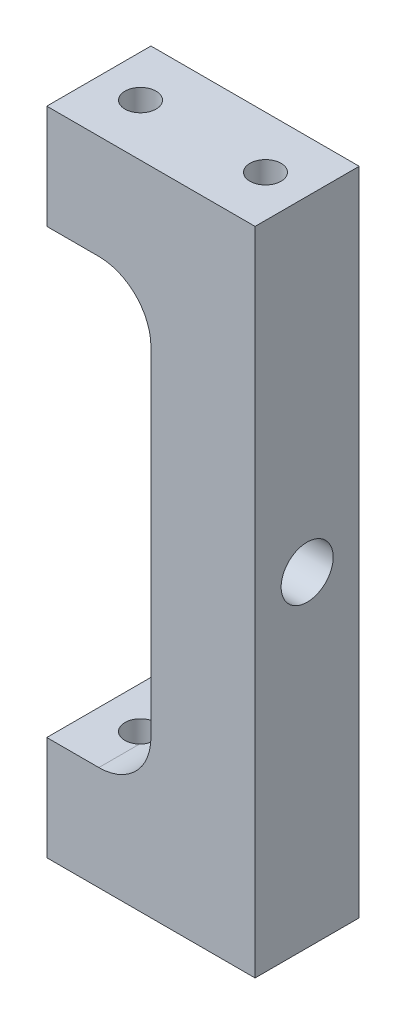
from build123d import *

# Parameters (mm, degrees)
SKETCH1_W                          = 25.4
SKETCH1_H                          = 12.7
STOCK_DEPTH                        = 79.375
SKETCH2_W                          = 12.7
SKETCH2_H                          = 53.975
CUTOUT_DEPTH                       = 85.302079601
FILLET1_R                          = 6.35
F_1_4_0_25_DIAMETER_HOLE1_D        = 6.35
MOUNTING_HOLES_ONE_SIDE_AT_2_COUNT = 2
MOUNTING_HOLES_ONE_SIDE_AT_2_PITCH = 15.24


with BuildPart() as part:
    # Sketch1 → Stock (new body)
    with BuildSketch(Plane(origin=(0, 0, 0), x_dir=(1, 0, 0), z_dir=(0, 1, 0))):
        with Locations((12.7, 6.35)):
            Rectangle(SKETCH1_W, SKETCH1_H)
    extrude(amount=STOCK_DEPTH)

    # Sketch2 → Cutout (cut, through all)
    with BuildSketch(Plane.XY):
        with Locations((6.35, 39.6875)):
            Rectangle(SKETCH2_W, SKETCH2_H)
    extrude(amount=-CUTOUT_DEPTH, mode=Mode.SUBTRACT)

    # Fillet1
    fillet1_edges = [part.edges().sort_by_distance(p)[0] for p in [
        (12.7, 12.7, -6.35),
        (12.7, 66.675, -6.35),
    ]]
    fillet(fillet1_edges, radius=FILLET1_R)

    # 1/4 (0.25) Diameter Hole1 (through all)
    with Locations(Plane.ZY.offset(-12.7)):
        with Locations((-6.35, 39.6875)):
            Hole(F_1_4_0_25_DIAMETER_HOLE1_D / 2)

    # Sketch8 → Mounting Holes One Side (revolve, cut)
    with BuildSketch(Plane(origin=(5.08, 79.375, -6.35), x_dir=(0, 0, 1), z_dir=(1, 0, 0))):
        Polygon((0, 0), (0, 13.840824014), (1.89865, 12.7), (1.89865, 0), align=None)
    mounting_holes_one_side = revolve(axis=Axis((5.08, 85.725, -6.35), (0, -1, 0)), mode=Mode.SUBTRACT)

    # Mounting Holes One Side at 2: Mounting Holes One Side ×2
    with Locations(*[(i * MOUNTING_HOLES_ONE_SIDE_AT_2_PITCH, 0, 0) for i in range(1, MOUNTING_HOLES_ONE_SIDE_AT_2_COUNT)]):
        add(mounting_holes_one_side, mode=Mode.SUBTRACT)

    # Mounting Holes: Mounting Holes One Side across plane
    add(mounting_holes_one_side.mirror(Plane(origin=(0, 39.6875, 0), x_dir=(0, 0, 1), z_dir=(0, -1, 0))), mode=Mode.SUBTRACT)

    # Mounting Holes copy 1 sketch → Mounting Holes copy 1 (revolve, cut)
    with BuildSketch(Plane(origin=(20.32, 0, -6.35), x_dir=(0, 0, 1), z_dir=(1, 0, 0))):
        Polygon((0, 0), (0, -13.840824014), (1.89865, -12.7), (1.89865, 0), align=None)
    revolve(axis=Axis((20.32, -6.35, -6.35), (0, -1, 0)), mode=Mode.SUBTRACT)


solid = part.part
